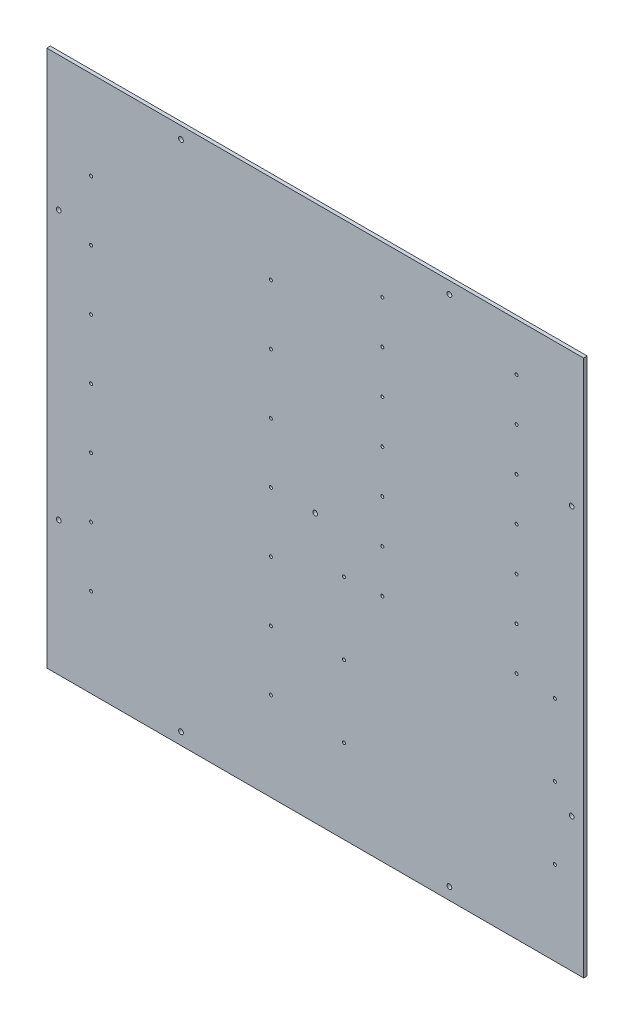
from build123d import *

# Parameters (mm, degrees)
SCHIZZO1_W                   = 448
SCHIZZO1_H                   = 448
SCHIZZO1_R                   = 2
SCHIZZO1_R_2                 = 1.25
ESTRUSIONE_ESTRUSIONE1_DEPTH = 3


with BuildPart() as part:
    # Schizzo1 → Estrusione-Estrusione1 (new body)
    with BuildSketch(Plane.XY):
        with Locations((224, 224)):
            Rectangle(SCHIZZO1_W, SCHIZZO1_H)
        with Locations((10, 336)):
            Circle(SCHIZZO1_R, mode=Mode.SUBTRACT)
        with Locations((336, 438)):
            Circle(SCHIZZO1_R, mode=Mode.SUBTRACT)
        with Locations((438, 336)):
            Circle(SCHIZZO1_R, mode=Mode.SUBTRACT)
        with Locations((438, 112)):
            Circle(SCHIZZO1_R, mode=Mode.SUBTRACT)
        with Locations((336, 10)):
            Circle(SCHIZZO1_R, mode=Mode.SUBTRACT)
        with Locations((112, 10)):
            Circle(SCHIZZO1_R, mode=Mode.SUBTRACT)
        with Locations((10, 112)):
            Circle(SCHIZZO1_R, mode=Mode.SUBTRACT)
        with Locations((36.958788995, 224)):
            Circle(SCHIZZO1_R_2, mode=Mode.SUBTRACT)
        with Locations((112, 438)):
            Circle(SCHIZZO1_R, mode=Mode.SUBTRACT)
        with Locations((36.958788995, 274)):
            Circle(SCHIZZO1_R_2, mode=Mode.SUBTRACT)
        with Locations((187.041211005, 274)):
            Circle(SCHIZZO1_R_2, mode=Mode.SUBTRACT)
        with Locations((36.958788995, 324)):
            Circle(SCHIZZO1_R_2, mode=Mode.SUBTRACT)
        with Locations((187.041211005, 324)):
            Circle(SCHIZZO1_R_2, mode=Mode.SUBTRACT)
        with Locations((36.958788995, 374)):
            Circle(SCHIZZO1_R_2, mode=Mode.SUBTRACT)
        with Locations((187.041211005, 374)):
            Circle(SCHIZZO1_R_2, mode=Mode.SUBTRACT)
        with Locations((36.958788995, 174)):
            Circle(SCHIZZO1_R_2, mode=Mode.SUBTRACT)
        with Locations((248, 70)):
            Circle(SCHIZZO1_R_2, mode=Mode.SUBTRACT)
        with Locations((248, 130)):
            Circle(SCHIZZO1_R_2, mode=Mode.SUBTRACT)
        with Locations((424, 130)):
            Circle(SCHIZZO1_R_2, mode=Mode.SUBTRACT)
        with Locations((424, 70)):
            Circle(SCHIZZO1_R_2, mode=Mode.SUBTRACT)
        with Locations((187.041211005, 174)):
            Circle(SCHIZZO1_R_2, mode=Mode.SUBTRACT)
        with Locations((280, 408)):
            Circle(SCHIZZO1_R_2, mode=Mode.SUBTRACT)
        with Locations((392, 408)):
            Circle(SCHIZZO1_R_2, mode=Mode.SUBTRACT)
        with Locations((36.958788995, 124)):
            Circle(SCHIZZO1_R_2, mode=Mode.SUBTRACT)
        with Locations((187.041211005, 124)):
            Circle(SCHIZZO1_R_2, mode=Mode.SUBTRACT)
        with Locations((280, 372)):
            Circle(SCHIZZO1_R_2, mode=Mode.SUBTRACT)
        with Locations((392, 372)):
            Circle(SCHIZZO1_R_2, mode=Mode.SUBTRACT)
        with Locations((36.958788995, 74)):
            Circle(SCHIZZO1_R_2, mode=Mode.SUBTRACT)
        with Locations((187.041211005, 74)):
            Circle(SCHIZZO1_R_2, mode=Mode.SUBTRACT)
        with Locations((280, 336)):
            Circle(SCHIZZO1_R_2, mode=Mode.SUBTRACT)
        with Locations((392, 336)):
            Circle(SCHIZZO1_R_2, mode=Mode.SUBTRACT)
        with Locations((280, 300)):
            Circle(SCHIZZO1_R_2, mode=Mode.SUBTRACT)
        with Locations((392, 300)):
            Circle(SCHIZZO1_R_2, mode=Mode.SUBTRACT)
        with Locations((280, 264)):
            Circle(SCHIZZO1_R_2, mode=Mode.SUBTRACT)
        with Locations((392, 264)):
            Circle(SCHIZZO1_R_2, mode=Mode.SUBTRACT)
        with Locations((280, 228)):
            Circle(SCHIZZO1_R_2, mode=Mode.SUBTRACT)
        with Locations((392, 228)):
            Circle(SCHIZZO1_R_2, mode=Mode.SUBTRACT)
        with Locations((280, 192)):
            Circle(SCHIZZO1_R_2, mode=Mode.SUBTRACT)
        with Locations((392, 192)):
            Circle(SCHIZZO1_R_2, mode=Mode.SUBTRACT)
        with Locations((187.041211005, 224)):
            Circle(SCHIZZO1_R_2, mode=Mode.SUBTRACT)
        with Locations((224, 224)):
            Circle(SCHIZZO1_R, mode=Mode.SUBTRACT)
        with Locations((424, 190)):
            Circle(SCHIZZO1_R_2, mode=Mode.SUBTRACT)
        with Locations((248, 190)):
            Circle(SCHIZZO1_R_2, mode=Mode.SUBTRACT)
    extrude(amount=-ESTRUSIONE_ESTRUSIONE1_DEPTH)


solid = part.part
